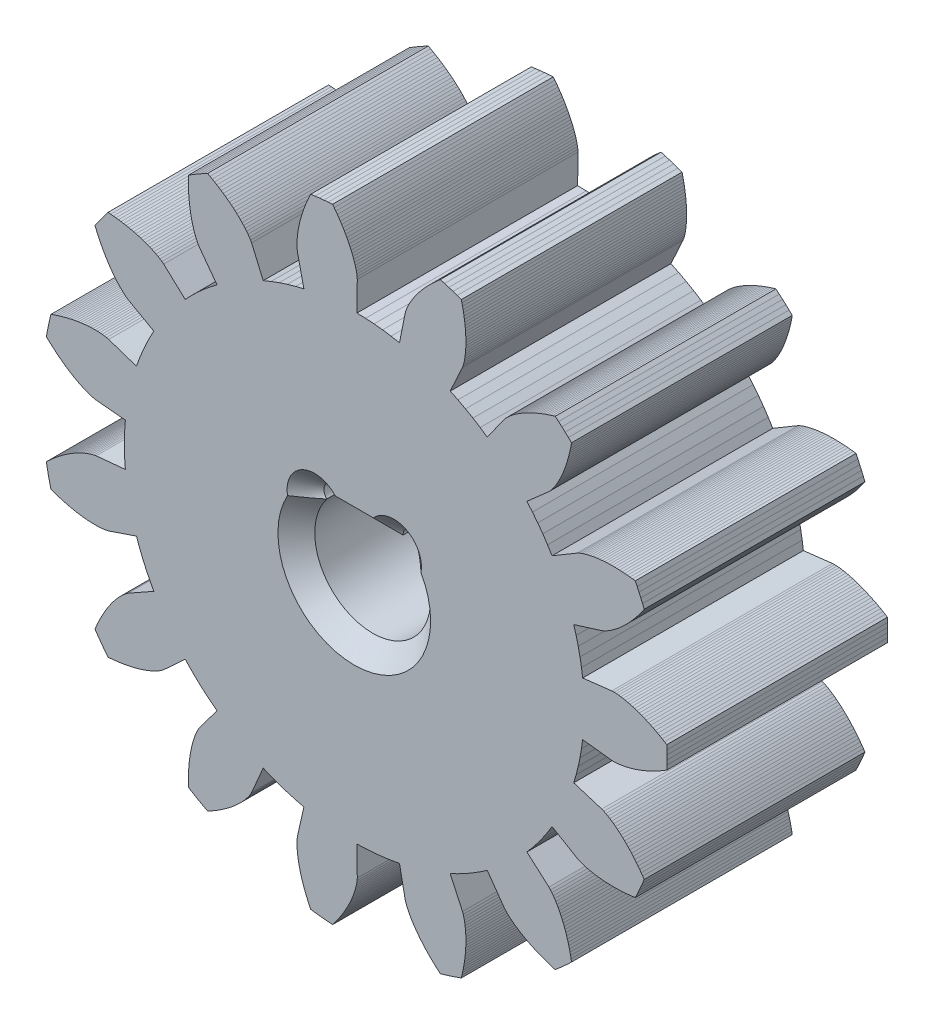
from build123d import *

# Parameters (mm, degrees)
BOSS_EXTRUDE1_DEPTH = 6
CUT_EXTRUDE1_DEPTH  = 14.421941733
CHAMFER1_SIZE       = 0.5


with BuildPart() as part:
    # Model → Boss-Extrude1 (new body)
    with BuildSketch(Plane.XY):
        Polygon((6.20779, -0.72518), (7.00009, -0.81774), (7.06081, -0.81948), (7.12204, -0.81679), (7.18358, -0.81113), (7.24538, -0.80301), (7.30738, -0.79274), (7.36956, -0.78049), (7.43187, -0.7664), (7.4943, -0.75057), (7.55683, -0.73309), (7.61944, -0.71401), (7.6821, -0.6934), (7.74481, -0.67129), (7.80754, -0.64774), (7.87027, -0.62276), (7.933, -0.59638), (7.9957, -0.56864), (8.05837, -0.53956), (8.12098, -0.50915), (8.18352, -0.47744), (8.24598, -0.44443), (8.30834, -0.41016), (8.3706, -0.37462), (8.43272, -0.33783), (8.49471, -0.2998), (8.4981, -0.1799), (8.49979, -0.05997), (8.49979, 0.05997), (8.4981, 0.1799), (8.49471, 0.2998), (8.43272, 0.33783), (8.3706, 0.37462), (8.30834, 0.41016), (8.24598, 0.44443), (8.18352, 0.47744), (8.12098, 0.50915), (8.05837, 0.53956), (7.9957, 0.56864), (7.933, 0.59638), (7.87027, 0.62276), (7.80754, 0.64774), (7.74481, 0.67129), (7.6821, 0.6934), (7.61944, 0.71401), (7.55683, 0.73309), (7.4943, 0.75057), (7.43187, 0.7664), (7.36956, 0.78049), (7.30738, 0.79274), (7.24538, 0.80301), (7.18358, 0.81113), (7.12204, 0.81679), (7.06081, 0.81948), (7.00009, 0.81774), (6.20779, 0.72518), (6.17646, 0.95592), (6.13657, 1.18534), (6.08815, 1.41311), (6.03129, 1.63892), (5.96605, 1.86245), (6.72751, 2.10016), (6.78369, 2.12326), (6.83852, 2.15062), (6.89245, 2.18083), (6.9456, 2.21337), (6.99806, 2.24798), (7.04988, 2.28446), (7.10107, 2.32268), (7.15167, 2.36253), (7.20168, 2.40393), (7.25112, 2.44682), (7.29998, 2.49114), (7.34828, 2.53684), (7.396, 2.58388), (7.44315, 2.63221), (7.48973, 2.68182), (7.53573, 2.73266), (7.58114, 2.78472), (7.62597, 2.83797), (7.67021, 2.89238), (7.71385, 2.94793), (7.75688, 3.00461), (7.79929, 3.0624), (7.84108, 3.12128), (7.88224, 3.18123), (7.83657, 3.29214), (7.78934, 3.40239), (7.74055, 3.51196), (7.69022, 3.62084), (7.63836, 3.72899), (7.56627, 3.73852), (7.49455, 3.74686), (7.42322, 3.754), (7.35231, 3.75995), (7.28183, 3.7647), (7.21179, 3.76823), (7.14223, 3.77055), (7.07315, 3.77163), (7.00458, 3.77147), (6.93655, 3.77004), (6.86908, 3.76735), (6.80219, 3.76336), (6.73592, 3.75805), (6.67029, 3.75139), (6.60534, 3.74335), (6.5411, 3.73389), (6.47763, 3.72295), (6.41497, 3.71048), (6.35319, 3.69638), (6.29237, 3.68055), (6.23262, 3.66283), (6.17409, 3.64296), (6.11706, 3.62052), (6.0623, 3.59423), (5.37614, 3.18742), (5.25367, 3.38547), (5.12391, 3.57883), (4.98704, 3.76721), (4.84325, 3.95037), (4.69273, 4.12804), (5.29167, 4.65491), (5.3336, 4.69887), (5.37256, 4.74617), (5.40954, 4.79569), (5.44486, 4.84705), (5.47871, 4.9), (5.51121, 4.9544), (5.54244, 5.01014), (5.57245, 5.06713), (5.6013, 5.12529), (5.62901, 5.18458), (5.65563, 5.24494), (5.68116, 5.30633), (5.70562, 5.36871), (5.72904, 5.43205), (5.75141, 5.49631), (5.77275, 5.56147), (5.79307, 5.6275), (5.81237, 5.69437), (5.83065, 5.76207), (5.84792, 5.83057), (5.86417, 5.89986), (5.87942, 5.9699), (5.89365, 6.04068), (5.90687, 6.11219), (5.82003, 6.19494), (5.73204, 6.27644), (5.6429, 6.3567), (5.55264, 6.4357), (5.46128, 6.51341), (5.39154, 6.49278), (5.32263, 6.47123), (5.25456, 6.44875), (5.18736, 6.42534), (5.12104, 6.40101), (5.05562, 6.37575), (4.99113, 6.34957), (4.92758, 6.32246), (4.86501, 6.29443), (4.80344, 6.26546), (4.7429, 6.23555), (4.68342, 6.2047), (4.62503, 6.17289), (4.56779, 6.14011), (4.51172, 6.10635), (4.45689, 6.07158), (4.40335, 6.03578), (4.35118, 5.99889), (4.30048, 5.96089), (4.25135, 5.92169), (4.20397, 5.88119), (4.15858, 5.83924), (4.11561, 5.79555), (4.07628, 5.74926), (3.61491, 5.09852), (3.42247, 5.22964), (3.22529, 5.3535), (3.02363, 5.46993), (2.81777, 5.57877), (2.608, 5.67986), (2.94086, 6.40479), (2.96128, 6.462), (2.97764, 6.52106), (2.99128, 6.58134), (3.00266, 6.64262), (3.01204, 6.70477), (3.0196, 6.76768), (3.02546, 6.8313), (3.0297, 6.89557), (3.0324, 6.96044), (3.0336, 7.02588), (3.03336, 7.09184), (3.03172, 7.15831), (3.0287, 7.22525), (3.02432, 7.29263), (3.01863, 7.36044), (3.01162, 7.42864), (3.00333, 7.49723), (2.99375, 7.56617), (2.98292, 7.63545), (2.97083, 7.70506), (2.9575, 7.77496), (2.94294, 7.84515), (2.92715, 7.9156), (2.91014, 7.98631), (2.79716, 8.02658), (2.68362, 8.06525), (2.56954, 8.10231), (2.45496, 8.13776), (2.33988, 8.17159), (2.28456, 8.12439), (2.23038, 8.07667), (2.17734, 8.02845), (2.12547, 7.97973), (2.07478, 7.93053), (2.02529, 7.88085), (1.97702, 7.8307), (1.93, 7.78009), (1.88424, 7.72902), (1.83977, 7.67752), (1.79663, 7.62557), (1.75484, 7.57319), (1.71444, 7.52039), (1.67547, 7.46716), (1.63798, 7.41351), (1.60203, 7.35945), (1.56769, 7.30496), (1.53503, 7.25005), (1.50417, 7.1947), (1.47524, 7.13891), (1.44842, 7.08265), (1.42402, 7.02586), (1.40254, 6.96846), (1.38543, 6.91018), (1.22862, 6.12805), (0.9995, 6.16956), (0.76898, 6.20251), (0.5374, 6.22685), (0.30507, 6.24255), (0.07232, 6.24958), (0.08155, 7.04722), (0.07694, 7.10779), (0.06786, 7.1684), (0.05579, 7.22902), (0.04127, 7.28963), (0.02456, 7.35022), (0.00588, 7.41077), (-0.01464, 7.47127), (-0.03691, 7.53171), (-0.06083, 7.59207), (-0.08635, 7.65233), (-0.1134, 7.7125), (-0.14194, 7.77255), (-0.17192, 7.83247), (-0.20332, 7.89225), (-0.23611, 7.95188), (-0.27025, 8.01134), (-0.30572, 8.07062), (-0.34251, 8.12971), (-0.38059, 8.1886), (-0.41994, 8.24726), (-0.46055, 8.3057), (-0.5024, 8.3639), (-0.54548, 8.42184), (-0.58978, 8.47951), (-0.70937, 8.47035), (-0.82883, 8.45949), (-0.94811, 8.44696), (-1.06721, 8.43274), (-1.1861, 8.41684), (-1.21744, 8.35122), (-1.24753, 8.28558), (-1.27637, 8.21996), (-1.30394, 8.15435), (-1.33023, 8.08878), (-1.35524, 8.02327), (-1.37893, 7.95782), (-1.40131, 7.89246), (-1.42234, 7.8272), (-1.44201, 7.76206), (-1.4603, 7.69706), (-1.47717, 7.63221), (-1.4926, 7.56754), (-1.50655, 7.50307), (-1.51897, 7.43881), (-1.52983, 7.37479), (-1.53904, 7.31105), (-1.54654, 7.2476), (-1.55222, 7.18449), (-1.55596, 7.12175), (-1.55757, 7.05945), (-1.55677, 6.99764), (-1.55305, 6.93647), (-1.54497, 6.87627), (-1.3701, 6.09798), (-1.5963, 6.04271), (-1.82029, 5.97905), (-2.04175, 5.90709), (-2.26038, 5.82694), (-2.47587, 5.73869), (-2.79187, 6.47113), (-2.82071, 6.52458), (-2.85366, 6.57626), (-2.88934, 6.62673), (-2.92726, 6.67619), (-2.96716, 6.72475), (-3.00886, 6.77247), (-3.05222, 6.81939), (-3.09714, 6.86554), (-3.14355, 6.91095), (-3.19137, 6.95563), (-3.24055, 6.9996), (-3.29105, 7.04285), (-3.34281, 7.08539), (-3.39581, 7.12723), (-3.45002, 7.16837), (-3.50539, 7.2088), (-3.56191, 7.24853), (-3.61955, 7.28755), (-3.67829, 7.32586), (-3.7381, 7.36345), (-3.79897, 7.40031), (-3.86087, 7.43646), (-3.9238, 7.47187), (-3.98772, 7.50654), (-4.09325, 7.44952), (-4.19796, 7.39102), (-4.30183, 7.33105), (-4.40485, 7.26961), (-4.50699, 7.20674), (-4.50893, 7.13404), (-4.50972, 7.06184), (-4.50938, 6.99016), (-4.50788, 6.91901), (-4.50523, 6.84842), (-4.50143, 6.7784), (-4.49646, 6.70897), (-4.49031, 6.64016), (-4.48298, 6.57199), (-4.47446, 6.50448), (-4.46472, 6.43766), (-4.45376, 6.37155), (-4.44155, 6.3062), (-4.42807, 6.24162), (-4.41329, 6.17787), (-4.39716, 6.11497), (-4.37965, 6.05299), (-4.3607, 5.99198), (-4.34022, 5.93201), (-4.31812, 5.87318), (-4.29425, 5.8156), (-4.26838, 5.75947), (-4.2401, 5.7051), (-4.20823, 5.65339), (-3.73192, 5.01351), (-3.91609, 4.87101), (-4.09482, 4.72176), (-4.26786, 4.56594), (-4.43499, 4.40379), (-4.59595, 4.23553), (-5.18254, 4.77611), (-5.23064, 4.81322), (-5.28175, 4.84702), (-5.33487, 4.87862), (-5.38964, 4.90838), (-5.44584, 4.93651), (-5.50334, 4.96314), (-5.56203, 4.98837), (-5.62185, 5.01226), (-5.68271, 5.03487), (-5.74457, 5.05624), (-5.80738, 5.0764), (-5.8711, 5.09537), (-5.9357, 5.11318), (-6.00114, 5.12985), (-6.06739, 5.14538), (-6.13442, 5.1598), (-6.20221, 5.1731), (-6.27074, 5.1853), (-6.33998, 5.19641), (-6.40991, 5.20642), (-6.48051, 5.21534), (-6.55176, 5.22318), (-6.62365, 5.22994), (-6.69615, 5.23561), (-6.76936, 5.1406), (-6.84122, 5.04457), (-6.91172, 4.94753), (-6.98085, 4.84951), (-7.04858, 4.75052), (-7.02079, 4.68332), (-6.99215, 4.61704), (-6.96267, 4.5517), (-6.93237, 4.48731), (-6.90124, 4.4239), (-6.86928, 4.36148), (-6.8365, 4.30008), (-6.8029, 4.23971), (-6.76848, 4.18042), (-6.73323, 4.12221), (-6.69716, 4.06513), (-6.66026, 4.0092), (-6.62252, 3.95446), (-6.58394, 3.90095), (-6.5445, 3.84872), (-6.50419, 3.79782), (-6.46299, 3.74832), (-6.42085, 3.70029), (-6.37776, 3.65384), (-6.33364, 3.60908), (-6.28841, 3.56619), (-6.24194, 3.52543), (-6.194, 3.48727), (-6.14385, 3.45299), (-5.44846, 3.06216), (-5.55874, 2.85708), (-5.66131, 2.64803), (-5.75602, 2.4353), (-5.84275, 2.21919), (-5.92136, 2), (-6.67711, 2.25527), (-6.73614, 2.2696), (-6.79658, 2.27969), (-6.85796, 2.28695), (-6.9201, 2.29187), (-6.98288, 2.2947), (-7.04624, 2.29565), (-7.11012, 2.29482), (-7.17448, 2.29232), (-7.23928, 2.28822), (-7.30449, 2.28258), (-7.37007, 2.27545), (-7.436, 2.26686), (-7.50225, 2.25686), (-7.56881, 2.24547), (-7.63565, 2.23271), (-7.70275, 2.21862), (-7.77009, 2.2032), (-7.83766, 2.18647), (-7.90543, 2.16845), (-7.97338, 2.14916), (-8.04151, 2.12859), (-8.10979, 2.10677), (-8.17821, 2.08371), (-8.24675, 2.0594), (-8.27499, 1.94283), (-8.30158, 1.82587), (-8.32652, 1.70854), (-8.3498, 1.59088), (-8.37141, 1.4729), (-8.31869, 1.42282), (-8.26557, 1.37392), (-8.21206, 1.32621), (-8.15819, 1.27971), (-8.10396, 1.23444), (-8.04937, 1.19042), (-7.99445, 1.14766), (-7.93921, 1.10618), (-7.88364, 1.06601), (-7.82777, 1.02717), (-7.7716, 0.9897), (-7.71514, 0.95361), (-7.6584, 0.91895), (-7.60139, 0.88576), (-7.54412, 0.85409), (-7.48659, 0.82399), (-7.42881, 0.79553), (-7.37079, 0.76879), (-7.31252, 0.74388), (-7.25401, 0.72093), (-7.19525, 0.70015), (-7.13622, 0.68182), (-7.0769, 0.66645), (-7.01714, 0.65553), (-6.2229, 0.58134), (-6.24024, 0.34913), (-6.24892, 0.11643), (-6.24892, -0.11643), (-6.24024, -0.34913), (-6.2229, -0.58134), (-7.01714, -0.65553), (-7.0769, -0.66645), (-7.13622, -0.68182), (-7.19525, -0.70015), (-7.25401, -0.72093), (-7.31252, -0.74388), (-7.37079, -0.76879), (-7.42881, -0.79553), (-7.48659, -0.82399), (-7.54412, -0.85409), (-7.60139, -0.88576), (-7.6584, -0.91895), (-7.71514, -0.95361), (-7.7716, -0.9897), (-7.82777, -1.02717), (-7.88364, -1.06601), (-7.93921, -1.10618), (-7.99445, -1.14766), (-8.04937, -1.19042), (-8.10396, -1.23444), (-8.15819, -1.27971), (-8.21206, -1.32621), (-8.26557, -1.37392), (-8.31869, -1.42282), (-8.37141, -1.4729), (-8.3498, -1.59088), (-8.32652, -1.70854), (-8.30158, -1.82587), (-8.27499, -1.94283), (-8.24675, -2.0594), (-8.17821, -2.08371), (-8.10979, -2.10677), (-8.04151, -2.12859), (-7.97338, -2.14916), (-7.90543, -2.16845), (-7.83766, -2.18647), (-7.77009, -2.2032), (-7.70275, -2.21862), (-7.63565, -2.23271), (-7.56881, -2.24547), (-7.50225, -2.25686), (-7.436, -2.26686), (-7.37007, -2.27545), (-7.30449, -2.28258), (-7.23928, -2.28822), (-7.17448, -2.29232), (-7.11012, -2.29482), (-7.04624, -2.29565), (-6.98288, -2.2947), (-6.9201, -2.29187), (-6.85796, -2.28695), (-6.79658, -2.27969), (-6.73614, -2.2696), (-6.67711, -2.25527), (-5.92136, -2), (-5.84275, -2.21919), (-5.75602, -2.4353), (-5.66131, -2.64803), (-5.55874, -2.85708), (-5.44846, -3.06216), (-6.14385, -3.45299), (-6.194, -3.48727), (-6.24194, -3.52543), (-6.28841, -3.56619), (-6.33364, -3.60908), (-6.37776, -3.65384), (-6.42085, -3.70029), (-6.46299, -3.74832), (-6.50419, -3.79782), (-6.5445, -3.84872), (-6.58394, -3.90095), (-6.62252, -3.95446), (-6.66026, -4.0092), (-6.69716, -4.06513), (-6.73323, -4.12221), (-6.76848, -4.18042), (-6.8029, -4.23971), (-6.8365, -4.30008), (-6.86928, -4.36148), (-6.90124, -4.4239), (-6.93237, -4.48731), (-6.96267, -4.5517), (-6.99215, -4.61704), (-7.02079, -4.68332), (-7.04858, -4.75052), (-6.98085, -4.84951), (-6.91172, -4.94753), (-6.84122, -5.04457), (-6.76936, -5.1406), (-6.69615, -5.23561), (-6.62365, -5.22994), (-6.55176, -5.22318), (-6.48051, -5.21534), (-6.40991, -5.20642), (-6.33998, -5.19641), (-6.27074, -5.1853), (-6.20221, -5.1731), (-6.13442, -5.1598), (-6.06739, -5.14538), (-6.00114, -5.12985), (-5.9357, -5.11318), (-5.8711, -5.09537), (-5.80738, -5.0764), (-5.74457, -5.05624), (-5.68271, -5.03487), (-5.62185, -5.01226), (-5.56203, -4.98837), (-5.50334, -4.96314), (-5.44584, -4.93651), (-5.38964, -4.90838), (-5.33487, -4.87862), (-5.28175, -4.84702), (-5.23064, -4.81322), (-5.18254, -4.77611), (-4.59595, -4.23553), (-4.43499, -4.40379), (-4.26786, -4.56594), (-4.09482, -4.72176), (-3.91609, -4.87101), (-3.73192, -5.01351), (-4.20823, -5.65339), (-4.2401, -5.7051), (-4.26838, -5.75947), (-4.29425, -5.8156), (-4.31812, -5.87318), (-4.34022, -5.93201), (-4.3607, -5.99198), (-4.37965, -6.05299), (-4.39716, -6.11497), (-4.41329, -6.17787), (-4.42807, -6.24162), (-4.44155, -6.3062), (-4.45376, -6.37155), (-4.46472, -6.43766), (-4.47446, -6.50448), (-4.48298, -6.57199), (-4.49031, -6.64016), (-4.49646, -6.70897), (-4.50143, -6.7784), (-4.50523, -6.84842), (-4.50788, -6.91901), (-4.50938, -6.99016), (-4.50972, -7.06184), (-4.50893, -7.13404), (-4.50699, -7.20674), (-4.40485, -7.26961), (-4.30183, -7.33105), (-4.19796, -7.39102), (-4.09325, -7.44952), (-3.98772, -7.50654), (-3.9238, -7.47187), (-3.86087, -7.43646), (-3.79897, -7.40031), (-3.7381, -7.36345), (-3.67829, -7.32586), (-3.61955, -7.28755), (-3.56191, -7.24853), (-3.50539, -7.2088), (-3.45002, -7.16837), (-3.39581, -7.12723), (-3.34281, -7.08539), (-3.29105, -7.04285), (-3.24055, -6.9996), (-3.19137, -6.95563), (-3.14355, -6.91095), (-3.09714, -6.86554), (-3.05222, -6.81939), (-3.00886, -6.77247), (-2.96716, -6.72475), (-2.92726, -6.67619), (-2.88934, -6.62673), (-2.85366, -6.57626), (-2.82071, -6.52458), (-2.79187, -6.47113), (-2.47587, -5.73869), (-2.26038, -5.82694), (-2.04175, -5.90709), (-1.82029, -5.97905), (-1.5963, -6.04271), (-1.3701, -6.09798), (-1.54497, -6.87627), (-1.55305, -6.93647), (-1.55677, -6.99764), (-1.55757, -7.05945), (-1.55596, -7.12175), (-1.55222, -7.18449), (-1.54654, -7.2476), (-1.53904, -7.31105), (-1.52983, -7.37479), (-1.51897, -7.43881), (-1.50655, -7.50307), (-1.4926, -7.56754), (-1.47717, -7.63221), (-1.4603, -7.69706), (-1.44201, -7.76206), (-1.42234, -7.8272), (-1.40131, -7.89246), (-1.37893, -7.95782), (-1.35524, -8.02327), (-1.33023, -8.08878), (-1.30394, -8.15435), (-1.27637, -8.21996), (-1.24753, -8.28558), (-1.21744, -8.35122), (-1.1861, -8.41684), (-1.06721, -8.43274), (-0.94811, -8.44696), (-0.82883, -8.45949), (-0.70937, -8.47035), (-0.58978, -8.47951), (-0.54548, -8.42184), (-0.5024, -8.3639), (-0.46055, -8.3057), (-0.41994, -8.24726), (-0.38059, -8.1886), (-0.34251, -8.12971), (-0.30572, -8.07062), (-0.27025, -8.01134), (-0.23611, -7.95188), (-0.20332, -7.89225), (-0.17192, -7.83247), (-0.14194, -7.77255), (-0.1134, -7.7125), (-0.08635, -7.65233), (-0.06083, -7.59207), (-0.03691, -7.53171), (-0.01464, -7.47127), (0.00588, -7.41077), (0.02456, -7.35022), (0.04127, -7.28963), (0.05579, -7.22902), (0.06786, -7.1684), (0.07694, -7.10779), (0.08155, -7.04722), (0.07232, -6.24958), (0.30507, -6.24255), (0.5374, -6.22685), (0.76898, -6.20251), (0.9995, -6.16956), (1.22862, -6.12805), (1.38543, -6.91018), (1.40254, -6.96846), (1.42402, -7.02586), (1.44842, -7.08265), (1.47524, -7.13891), (1.50417, -7.1947), (1.53503, -7.25005), (1.56769, -7.30496), (1.60203, -7.35945), (1.63798, -7.41351), (1.67547, -7.46716), (1.71444, -7.52039), (1.75484, -7.57319), (1.79663, -7.62557), (1.83977, -7.67752), (1.88424, -7.72902), (1.93, -7.78009), (1.97702, -7.8307), (2.02529, -7.88085), (2.07478, -7.93053), (2.12547, -7.97973), (2.17734, -8.02845), (2.23038, -8.07667), (2.28456, -8.12439), (2.33988, -8.17159), (2.45496, -8.13776), (2.56954, -8.10231), (2.68362, -8.06525), (2.79716, -8.02658), (2.91014, -7.98631), (2.92715, -7.9156), (2.94294, -7.84515), (2.9575, -7.77496), (2.97083, -7.70506), (2.98292, -7.63545), (2.99375, -7.56617), (3.00333, -7.49723), (3.01162, -7.42864), (3.01863, -7.36044), (3.02432, -7.29263), (3.0287, -7.22525), (3.03172, -7.15831), (3.03336, -7.09184), (3.0336, -7.02588), (3.0324, -6.96044), (3.0297, -6.89557), (3.02546, -6.8313), (3.0196, -6.76768), (3.01204, -6.70477), (3.00266, -6.64262), (2.99128, -6.58134), (2.97764, -6.52106), (2.96128, -6.462), (2.94086, -6.40479), (2.608, -5.67986), (2.81777, -5.57877), (3.02363, -5.46993), (3.22529, -5.3535), (3.42247, -5.22964), (3.61491, -5.09852), (4.07628, -5.74926), (4.11561, -5.79555), (4.15858, -5.83924), (4.20397, -5.88119), (4.25135, -5.92169), (4.30048, -5.96089), (4.35118, -5.99889), (4.40335, -6.03578), (4.45689, -6.07158), (4.51172, -6.10635), (4.56779, -6.14011), (4.62503, -6.17289), (4.68342, -6.2047), (4.7429, -6.23555), (4.80344, -6.26546), (4.86501, -6.29443), (4.92758, -6.32246), (4.99113, -6.34957), (5.05562, -6.37575), (5.12104, -6.40101), (5.18736, -6.42534), (5.25456, -6.44875), (5.32263, -6.47123), (5.39154, -6.49278), (5.46128, -6.51341), (5.55264, -6.4357), (5.6429, -6.3567), (5.73204, -6.27644), (5.82003, -6.19494), (5.90687, -6.11219), (5.89365, -6.04068), (5.87942, -5.9699), (5.86417, -5.89986), (5.84792, -5.83057), (5.83065, -5.76207), (5.81237, -5.69437), (5.79307, -5.6275), (5.77275, -5.56147), (5.75141, -5.49631), (5.72904, -5.43205), (5.70562, -5.36871), (5.68116, -5.30633), (5.65563, -5.24494), (5.62901, -5.18458), (5.6013, -5.12529), (5.57245, -5.06713), (5.54244, -5.01014), (5.51121, -4.9544), (5.47871, -4.9), (5.44486, -4.84705), (5.40954, -4.79569), (5.37256, -4.74617), (5.3336, -4.69887), (5.29167, -4.65491), (4.69273, -4.12804), (4.84325, -3.95037), (4.98704, -3.76721), (5.12391, -3.57883), (5.25367, -3.38547), (5.37614, -3.18742), (6.0623, -3.59423), (6.11706, -3.62052), (6.17409, -3.64296), (6.23262, -3.66283), (6.29237, -3.68055), (6.35319, -3.69638), (6.41497, -3.71048), (6.47763, -3.72295), (6.5411, -3.73389), (6.60534, -3.74335), (6.67029, -3.75139), (6.73592, -3.75805), (6.80219, -3.76336), (6.86908, -3.76735), (6.93655, -3.77004), (7.00458, -3.77147), (7.07315, -3.77163), (7.14223, -3.77055), (7.21179, -3.76823), (7.28183, -3.7647), (7.35231, -3.75995), (7.42322, -3.754), (7.49455, -3.74686), (7.56627, -3.73852), (7.63836, -3.72899), (7.69022, -3.62084), (7.74055, -3.51196), (7.78934, -3.40239), (7.83657, -3.29214), (7.88224, -3.18123), (7.84108, -3.12128), (7.79929, -3.0624), (7.75688, -3.00461), (7.71385, -2.94793), (7.67021, -2.89238), (7.62597, -2.83797), (7.58114, -2.78472), (7.53573, -2.73266), (7.48973, -2.68182), (7.44315, -2.63221), (7.396, -2.58388), (7.34828, -2.53684), (7.29998, -2.49114), (7.25112, -2.44682), (7.20168, -2.40393), (7.15167, -2.36253), (7.10107, -2.32268), (7.04988, -2.28446), (6.99806, -2.24798), (6.9456, -2.21337), (6.89245, -2.18083), (6.83852, -2.15062), (6.78369, -2.12326), (6.72751, -2.10016), (5.96605, -1.86245), (6.03129, -1.63892), (6.08815, -1.41311), (6.13657, -1.18534), (6.17646, -0.95592), align=None)
        Polygon((-1.11803, 1), (-1.22796, 0.86145), (-1.32082, 0.71093), (-1.39532, 0.55053), (-1.45042, 0.38247), (-1.48536, 0.20909), (-1.49964, 0.03281), (-1.49308, -0.14393), (-1.46576, -0.31867), (-1.41806, -0.48898), (-1.35065, -0.65249), (-1.26446, -0.80693), (-1.1607, -0.95015), (-1.0408, -1.08016), (-0.90642, -1.19515), (-0.75945, -1.29354), (-0.60192, -1.37393), (-0.43602, -1.43523), (-0.26406, -1.47657), (-0.08843, -1.49739), (0.08843, -1.49739), (0.26406, -1.47657), (0.43602, -1.43523), (0.60192, -1.37393), (0.75945, -1.29354), (0.90642, -1.19515), (1.0408, -1.08016), (1.1607, -0.95015), (1.26446, -0.80693), (1.35065, -0.65249), (1.41806, -0.48898), (1.46576, -0.31867), (1.49308, -0.14393), (1.49964, 0.03281), (1.48536, 0.20909), (1.45042, 0.38247), (1.39532, 0.55053), (1.32082, 0.71093), (1.22796, 0.86145), (1.11803, 1), align=None, mode=Mode.SUBTRACT)
    extrude(amount=BOSS_EXTRUDE1_DEPTH)

    # Sketch2 → Cut-Extrude1 (cut, through all)
    with BuildSketch(Plane.XY.offset(6)):
        with BuildLine():
            Line((-0.826162163, 1.15), (0.826162163, 1.15))
            ThreePointArc((0.826162163, 1.15), (1.177153011, 1.378693788), (1.24456895, 0.965232163))
            ThreePointArc((1.24456895, 0.965232163), (0, -1.575), (-1.24456895, 0.965232163))
            ThreePointArc((-1.24456895, 0.965232163), (-1.177153011, 1.378693788), (-0.826162163, 1.15))
        make_face()
    extrude(amount=-CUT_EXTRUDE1_DEPTH, mode=Mode.SUBTRACT)

    # Chamfer1
    chamfer1_edges = [part.edges().sort_by_distance(p)[0] for p in [
        (1.177153011, 1.378693788, 6),
        (0, 1.15, 6),
        (-1.177153011, 1.378693788, 6),
        (0, -1.575, 6),
    ]]
    chamfer(chamfer1_edges, length=CHAMFER1_SIZE)


solid = part.part
